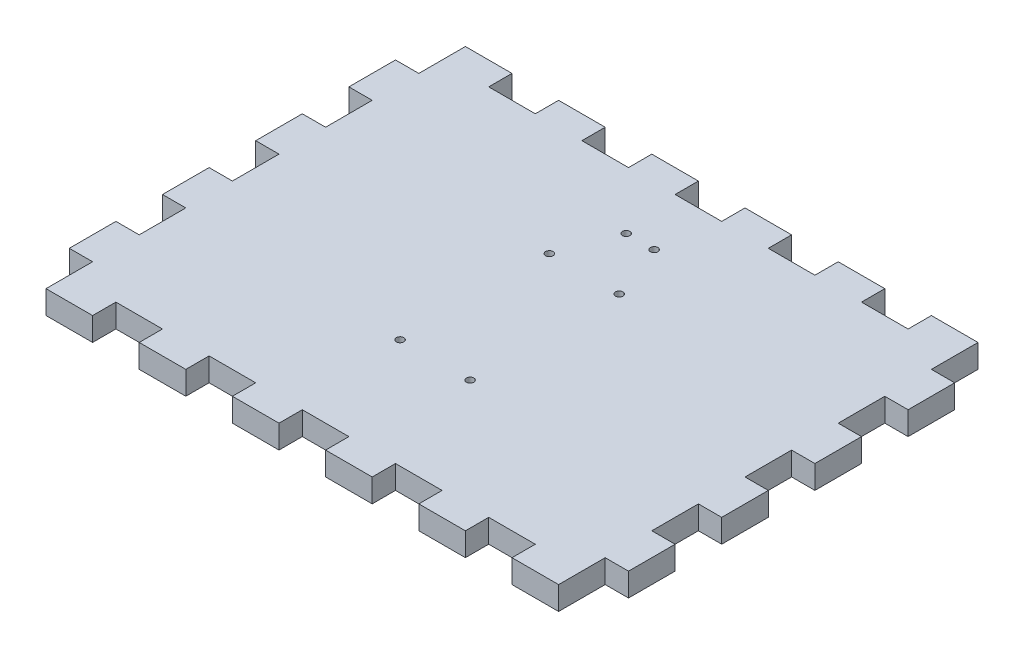
from build123d import *

# Parameters (mm, degrees)
BOSS_EXTRUDE1_DEPTH               = 2.5
TAP_DRILL_FOR_M2_TAP2_D           = 1.6
TAP_DRILL_FOR_M2_TAP2_CSINK_D     = 1.65
TAP_DRILL_FOR_M2_TAP2_CSINK_ANGLE = 90


# Read off the part's stored shape, not the designer's step: Tap Drill for M2 Tap1
with BuildPart() as part:
    # Sketch1 → Boss-Extrude1 (new, symmetric)
    with BuildSketch(Plane(origin=(0, 0, 0), x_dir=(1, 0, 0), z_dir=(0, 1, 0))):
        Polygon((55, 45), (45, 45), (45, 40), (35, 40), (35, 45), (25, 45), (25, 40), (15, 40), (15, 45), (5, 45), (5, 40), (-5, 40), (-5, 45), (-15, 45), (-15, 40), (-25, 40), (-25, 45), (-35, 45), (-35, 40), (-45, 40), (-45, 45), (-55, 45), (-55, 40), (-55, 35), (-60, 35), (-60, 25), (-55, 25), (-55, 15), (-60, 15), (-60, 5), (-55, 5), (-55, -5), (-60, -5), (-60, -15), (-55, -15), (-55, -25), (-60, -25), (-60, -35), (-55, -35), (-55, -40), (-55, -45), (-45, -45), (-45, -40), (-35, -40), (-35, -45), (-25, -45), (-25, -40), (-15, -40), (-15, -45), (-5, -45), (-5, -40), (5, -40), (5, -45), (15, -45), (15, -40), (25, -40), (25, -45), (35, -45), (35, -40), (45, -40), (45, -45), (55, -45), (55, -40), (55, -35), (60, -35), (60, -25), (55, -25), (55, -15), (60, -15), (60, -5), (55, -5), (55, 5), (60, 5), (60, 15), (55, 15), (55, 25), (60, 25), (60, 35), (55, 35), (55, 40), align=None)
    extrude(amount=BOSS_EXTRUDE1_DEPTH, both=True)

    # Tap Drill for M2 Tap1 outline → Tap Drill for M2 Tap1 (revolve, cut)
    with BuildSketch(Plane(origin=(3, 0, -27.5), x_dir=(1, 0, 0), z_dir=(0, 0, 1))):
        Polygon((0.8, -2.475), (0.8, 2.5), (0, 2.5), (0, -2.5), (0.825, -2.5), align=None)
    revolve(axis=Axis((3, 0, -27.5), (0, 1, 0)), mode=Mode.SUBTRACT)

    # Tap Drill for M2 Tap1 2 outline → Tap Drill for M2 Tap1 2 (revolve, cut)
    with BuildSketch(Plane(origin=(-3, 0, -27.5), x_dir=(1, 0, 0), z_dir=(0, 0, 1))):
        Polygon((0.8, -2.475), (0.8, 2.5), (0, 2.5), (0, -2.5), (0.825, -2.5), align=None)
    revolve(axis=Axis((-3, 0, -27.5), (0, 1, 0)), mode=Mode.SUBTRACT)

    # Tap Drill for M2 Tap2 (through all)
    with Locations(Plane(origin=(0, -2.5, 0), x_dir=(-1, 0, 0), z_dir=(0, -1, 0))):
        with Locations((-7.5, 15.5), (7.5, 15.5), (-7.5, -16.5), (7.5, -16.5)):
            CounterSinkHole(TAP_DRILL_FOR_M2_TAP2_D / 2, TAP_DRILL_FOR_M2_TAP2_CSINK_D / 2, counter_sink_angle=TAP_DRILL_FOR_M2_TAP2_CSINK_ANGLE)


solid = part.part
